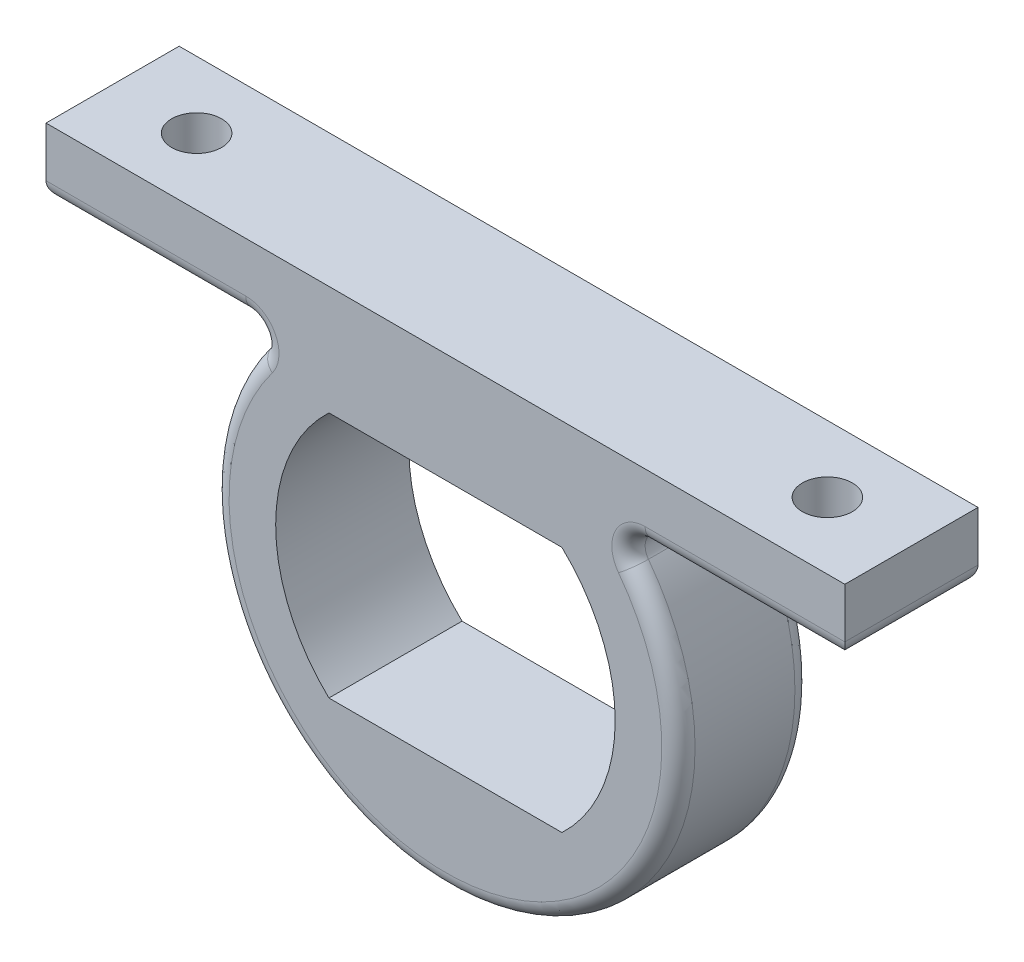
from build123d import *

# Parameters (mm, degrees)
SALIENTE_EXTRUIR1_DEPTH = 8
CORTAR_EXTRUIR1_DEPTH   = 29.91366459
REDONDEO1_R             = 1
CROQUIS3_R              = 1.5
CORTAR_EXTRUIR2_DEPTH   = 35.871191548


with BuildPart() as part:
    # Croquis1 → Saliente-Extruir1 (new body)
    with BuildSketch(Plane.XY):
        with BuildLine():
            Line((0, 14), (-24, 14))
            Line((-24, 14), (-24, 10))
            Line((-24, 10), (-9.797958971, 10))
            ThreePointArc((-9.797958971, 10), (0, -14), (9.797958971, 10))
            Line((9.797958971, 10), (24, 10))
            Line((24, 10), (24, 14))
            Line((24, 14), (0, 14))
        make_face()
    extrude(amount=SALIENTE_EXTRUIR1_DEPTH)

    # Croquis2 → Cortar-Extruir1 (cut, through all)
    with BuildSketch(Plane.XY.offset(8)):
        with BuildLine():
            Line((-7, 7.418894796), (7, 7.418894796))
            ThreePointArc((7, 7.418894796), (10.2, 0), (7, -7.418894796))
            Line((7, -7.418894796), (-7, -7.418894796))
            ThreePointArc((-7, -7.418894796), (-10.2, 0), (-7, 7.418894796))
        make_face()
    extrude(amount=-CORTAR_EXTRUIR1_DEPTH, mode=Mode.SUBTRACT)

    # Redondeo1
    redondeo1_edges = [part.edges().sort_by_distance(p)[0] for p in [
        (-16.898979486, 10, 8),
        (-16.898979486, 10, 0),
        (16.898979486, 10, 8),
        (16.898979486, 10, 0),
        (-9.797958971, 10, 4),
        (0, -14, 8),
        (9.797958971, 10, 4),
        (0, -14, 0),
        (24, 10, 4),
        (-24, 10, 4),
    ]]
    fillet(redondeo1_edges, radius=REDONDEO1_R)

    # Croquis3 → Cortar-Extruir2 (cut, through all)
    with BuildSketch(Plane(origin=(0, 10, 0), x_dir=(-1, 0, 0), z_dir=(0, -1, 0))):
        with Locations((18.949489743, -4)):
            Circle(CROQUIS3_R)
        with Locations((-18.949489743, -4)):
            Circle(CROQUIS3_R)
    extrude(amount=-CORTAR_EXTRUIR2_DEPTH, mode=Mode.SUBTRACT)


solid = part.part
